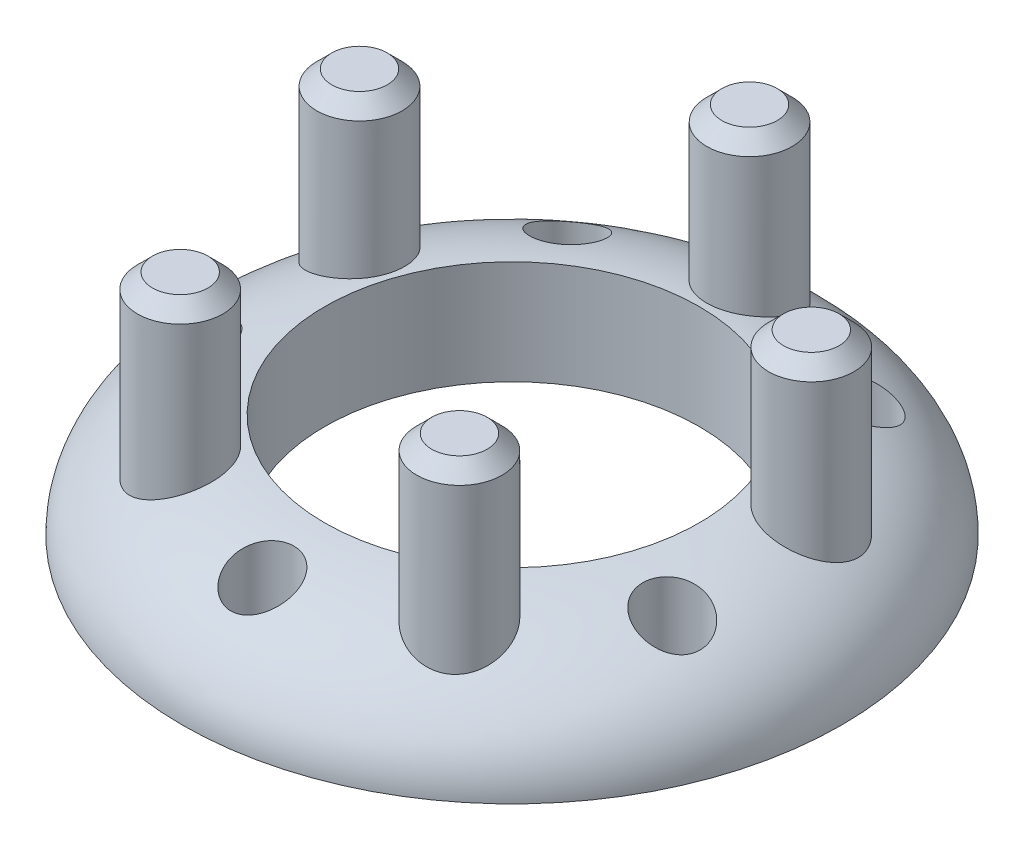
from build123d import *

# Parameters (mm, degrees)
SKIZZE10_R                      = 2.1
SCHNITT_LINEAR_AUSTRAGEN2_DEPTH = 32.876148669
AUFSATZ_LINEAR_START            = -16.934612
SKIZZE11_R                      = 2.85
AUFSATZ_LINEAR_AUSTRAGEN2_DEPTH = 16.934612
FASE2_SIZE                      = 1


with BuildPart() as part:
    # Skizze9 → Rotation3 (revolve)
    with BuildSketch(Plane.XY, mode=Mode.PRIVATE) as rotation3_sk:
        with BuildLine():
            Line((-22.535926767, 1.075405754), (-13.035926767, 1.075405754))
            Line((-13.035926767, 1.075405754), (-13.035926767, 8.010017709))
            add(Edge.make_bspline(
                [(-13.035926767, 8.010017709), (-18.805620772, 7.504620795), (-22.535926767, 4.706629491), (-22.535926767, 1.075405754)],
                knots=[0.094203165, 0.094203165, 0.094203165, 0.094203165, 1, 1, 1, 1], degree=3, weights=[0.950015471, 0.806470657, 0.823132166, 1]))
        make_face()
    revolve(rotation3_sk.sketch.rotate(Axis((-0.535926767, -5.924594246, 0), (0, 1, 0)), 270), axis=Axis((-0.535926767, -5.924594246, 0), (0, 1, 0)))


with BuildPart() as part_1:
    # Körper-Verschieben/Kopieren1: read off the stored shape, not the designer's step
    # Körper-Verschieben/Kopieren1: moved
    add(part.part.moved(Location((0.5359268, -1.0754058, 0))))

    # Skizze10 → Schnitt-Linear austragen2 (cut, through all)
    with BuildSketch(Plane.XZ):
        with Locations(Location((0, 16.655, 0), (0, 0, 270))):
            Circle(SKIZZE10_R)
        with Locations(Location((15.839846279, 5.146678041, 0), (0, 0, 270))):
            Circle(SKIZZE10_R)
        with Locations(Location((9.789563377, -13.474178041, 0), (0, 0, 270))):
            Circle(SKIZZE10_R)
        with Locations(Location((-9.789563377, -13.474178041, 0), (0, 0, 270))):
            Circle(SKIZZE10_R)
        with Locations(Location((-15.839846279, 5.146678041, 0), (0, 0, 270))):
            Circle(SKIZZE10_R)
    extrude(amount=-SCHNITT_LINEAR_AUSTRAGEN2_DEPTH, mode=Mode.SUBTRACT)

    # Skizze11 → Aufsatz-Linear austragen2 (add)
    with BuildSketch(Plane.XZ.offset(AUFSATZ_LINEAR_START)):
        with Locations(Location((-9.316396249, 12.822919361, 0), (0, 0, 270))):
            Circle(SKIZZE11_R)
        with Locations(Location((9.316396249, 12.822919361, 0), (0, 0, 270))):
            Circle(SKIZZE11_R)
        with Locations(Location((15.074245783, -4.897919361, 0), (0, 0, 270))):
            Circle(SKIZZE11_R)
        with Locations(Location((0, -15.85, 0), (0, 0, 90))):
            Circle(SKIZZE11_R)
        with Locations(Location((-15.074245783, -4.897919361, 0), (0, 0, 270))):
            Circle(SKIZZE11_R)
    extrude(amount=AUFSATZ_LINEAR_AUSTRAGEN2_DEPTH)

    # Fase2
    fase2_edges = [part_1.edges().sort_by_distance(p)[0] for p in [
        (-9.316396249, 16.934612, 15.672919361),
        (9.316396249, 16.934612, 15.672919361),
        (15.074245783, 16.934612, -2.047919361),
        (0, 16.934612, -18.7),
        (-15.074245783, 16.934612, -2.047919361),
    ]]
    chamfer(fase2_edges, length=FASE2_SIZE)


solid = part_1.part
